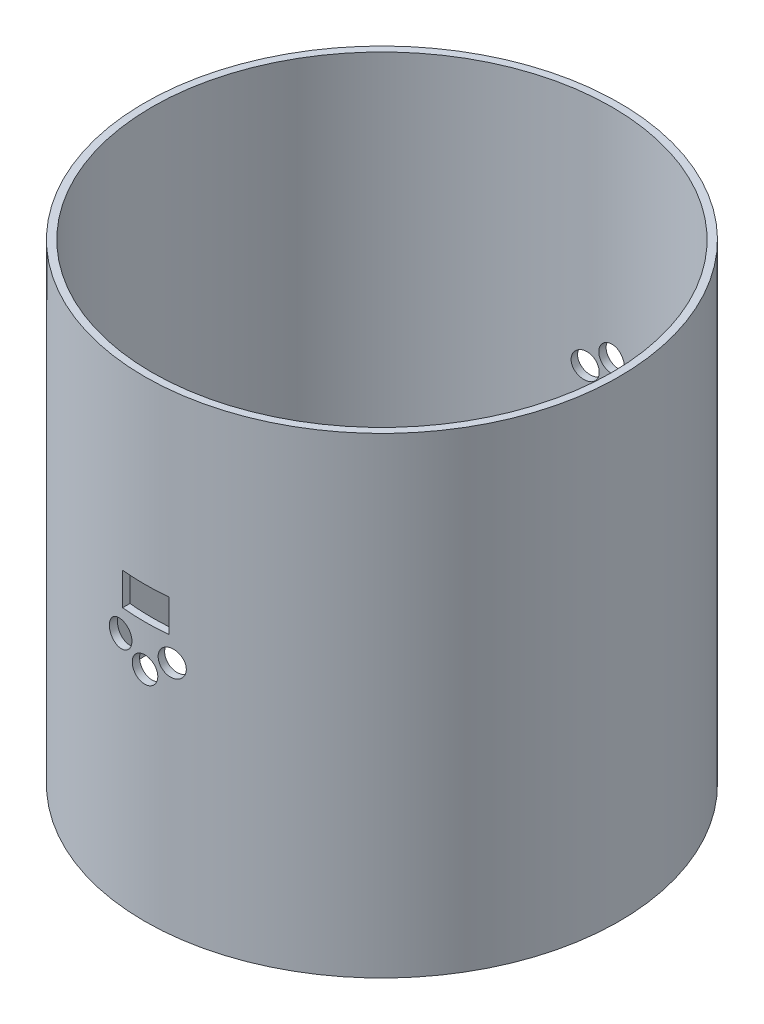
from build123d import *

# Parameters (mm, degrees)
SKETCH1_R               = 51.1048
SKETCH1_R_2             = 49.53
BOSS_EXTRUDE1_DEPTH     = 50.8
CUT_SWEEP1_START        = -51.104800053
CUT_SWEEP1_OUTLINE_R    = 2.749999961
CUT_SWEEP1_DEPTH        = 1.651201698
MIRROR2_START           = -51.104800053
MIRROR2_COPY_1_SKETCH_R = 2.749999961
MIRROR2_COPY_1_DEPTH    = 1.651201698
SKETCH18_R              = 2.749999961
SKETCH18_W              = 10.000000066
SKETCH18_H              = 6.99999997
CUT_EXTRUDE1_DEPTH      = 89.340484472
SKETCH18_3_R            = 2.749999961
SKETCH18_3_W            = 10.000000066
SKETCH18_3_H            = 6.99999997
CUT_EXTRUDE2_DEPTH      = 89.340484472


# Read off the part's stored shape, not the designer's step: Cut-Sweep1
with BuildPart() as part:
    # Sketch1 → Boss-Extrude1 (new, symmetric)
    with BuildSketch(Plane(origin=(0, 0, 0), x_dir=(1, 0, 0), z_dir=(0, 1, 0))):
        with Locations(Location((0, 0, 0), (0, 0, 270))):
            Circle(SKETCH1_R)
        with Locations(Location((0, 0, 0), (0, 0, 270))):
            Circle(SKETCH1_R_2, mode=Mode.SUBTRACT)
    extrude(amount=BOSS_EXTRUDE1_DEPTH, both=True)

    # Cut-Sweep1 outline → Cut-Sweep1 (cut)
    with BuildSketch(Plane(origin=(0, 0, 0), x_dir=(0.9940563382223202, 0, -0.10886687485195803), z_dir=(0.10886687485195805, 0, 0.9940563382223203)).offset(CUT_SWEEP1_START)):
        Circle(CUT_SWEEP1_OUTLINE_R)
    cut_sweep1 = extrude(amount=CUT_SWEEP1_DEPTH, mode=Mode.SUBTRACT)

    # Mirror1: Cut-Sweep1 across plane
    add(cut_sweep1.mirror(Plane(origin=(0, 0, 0), x_dir=(0, 0, 1), z_dir=(1, 0, 0))), mode=Mode.SUBTRACT)

    # Mirror2: Cut-Sweep1 across plane
    add(cut_sweep1.mirror(Plane.XY), mode=Mode.SUBTRACT)

    # Mirror2 copy 1 sketch → Mirror2 copy 1 (cut)
    with BuildSketch(Plane(origin=(0, 0, 0), x_dir=(-0.9940563382223202, 0, 0.10886687485195803), z_dir=(-0.10886687485195805, 0, -0.9940563382223203)).offset(MIRROR2_START)):
        Circle(MIRROR2_COPY_1_SKETCH_R)
    extrude(amount=MIRROR2_COPY_1_DEPTH, mode=Mode.SUBTRACT)

    # Sketch18 → Cut-Extrude1 (cut, through all)
    with BuildSketch(Plane.XY):
        with Locations(Location((0, 3.81, 0), (0, 0, 90))):
            Circle(SKETCH18_R)
        with Locations((0, -8.579999985)):
            Rectangle(SKETCH18_W, SKETCH18_H)
    extrude(amount=-CUT_EXTRUDE1_DEPTH, mode=Mode.SUBTRACT)

    # Sketch18<3> → Cut-Extrude2 (cut, through all)
    with BuildSketch(Plane.XY):
        with Locations(Location((0, -3.81, 0), (0, 0, 89.999999966))):
            Circle(SKETCH18_3_R)
        with Locations((0, 8.579999985)):
            Rectangle(SKETCH18_3_W, SKETCH18_3_H)
    extrude(amount=CUT_EXTRUDE2_DEPTH, mode=Mode.SUBTRACT)


solid = part.part
